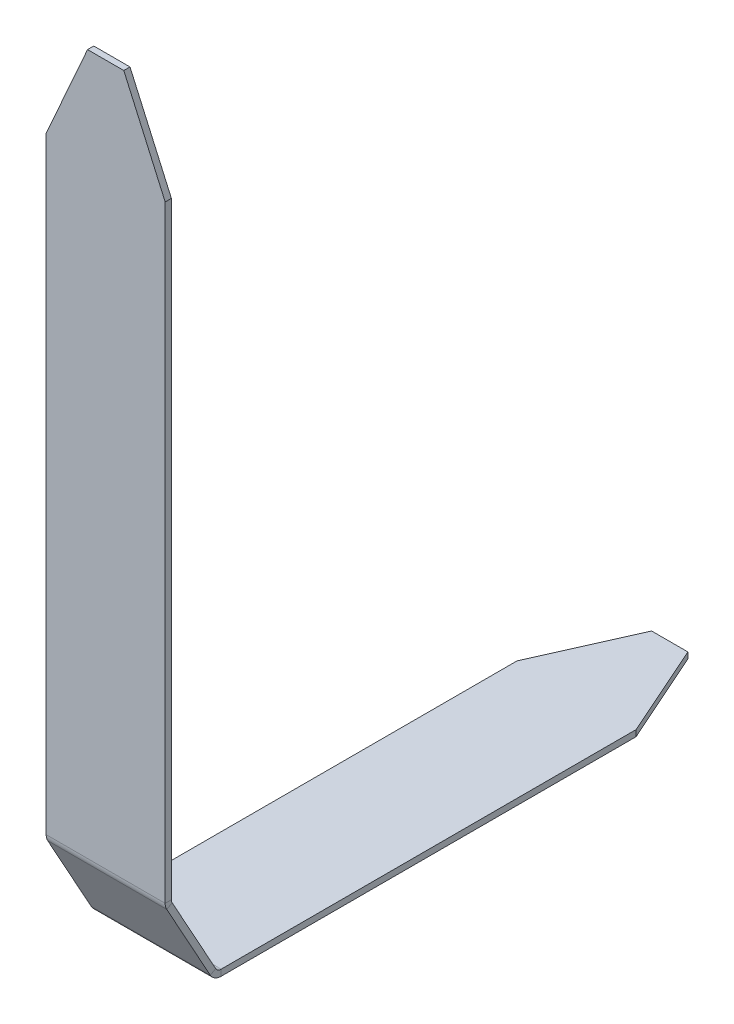
from build123d import *
from OCP.BRepFilletAPI import BRepFilletAPI_MakeChamfer

# Parameters (mm, degrees)
SM_BASE_FLANGE_1_DEPTH = 57.5
CHAMFER_1_SIZE         = 40
CHAMFER_1_SIZE2        = 90
CHAMFER_2_SIZE         = 90
CHAMFER_2_SIZE2        = 40


# Sheet-metal steps are written as plain solids
with BuildPart() as part:
    # Sketch 1 → 基体-法兰1 (new, symmetric)
    with BuildSketch(Plane(origin=(0, 0, 0), x_dir=(0, 0, -1), z_dir=(1, 0, 0))):
        with BuildLine():
            Line((545, 0), (54.077004305, 0))
            ThreePointArc((54.077004305, 0), (47.981132154, 1.663639774), (43.575482564, 6.193276214))
            Line((43.575482564, 6.193276214), (1.498478259, 82.289986127))
            ThreePointArc((1.498478259, 82.289986127), (0.380657056, 85.09823204), (0, 88.096709913))
            Line((0, 88.096709913), (0, 765))
            Line((0, 765), (6, 765))
            Line((6, 765), (6, 88.096709913))
            ThreePointArc((6, 88.096709913), (6.190328528, 86.597470976), (6.74923913, 85.19334802))
            Line((6.74923913, 85.19334802), (48.826243434, 9.096638107))
            ThreePointArc((48.826243434, 9.096638107), (51.029068229, 6.831819887), (54.077004305, 6))
            Line((54.077004305, 6), (545, 6))
            Line((545, 6), (545, 0))
        make_face()
    extrude(amount=SM_BASE_FLANGE_1_DEPTH, both=True)

    # 倒角1: one chamfer whose edges measure the first distance from different faces: ONE call of the kernel's chamfer builder (chamfer() names one face for all edges)
    chamfer_1_edges_1 = [part.edges().sort_by_distance(p)[0] for p in [
        (-57.5, 765, -3),
    ]]
    chamfer_1_side_1 = [part.faces().sort_by_distance(p)[0] for p in [
        (0, 765, -3),
    ]]
    chamfer_1_edges_2 = [part.edges().sort_by_distance(p)[0] for p in [
        (-57.5, 3, -545),
    ]]
    chamfer_1_side_2 = [part.faces().sort_by_distance(p)[0] for p in [
        (0, 3, -545),
    ]]
    chamfer_1 = BRepFilletAPI_MakeChamfer(part.part.solid().wrapped)
    for e in chamfer_1_edges_1:
        chamfer_1.Add(CHAMFER_1_SIZE, CHAMFER_1_SIZE2, e.wrapped, chamfer_1_side_1[0].wrapped)  # the first distance lies on this face
    for e in chamfer_1_edges_2:
        chamfer_1.Add(CHAMFER_1_SIZE, CHAMFER_1_SIZE2, e.wrapped, chamfer_1_side_2[0].wrapped)  # the first distance lies on this face
    add(Compound.cast(chamfer_1.Shape()), mode=Mode.REPLACE)

    # 倒角2
    chamfer_2_edges = [part.edges().sort_by_distance(p)[0] for p in [
        (57.5, 765, -3),
        (57.5, 3, -545),
    ]]
    chamfer_2_side = [part.faces().sort_by_distance(p)[0] for p in [
        (57.5, 6.022757105, -50.551923163),
    ]]
    chamfer(chamfer_2_edges, length=CHAMFER_2_SIZE, length2=CHAMFER_2_SIZE2, reference=chamfer_2_side[0])


solid = part.part
